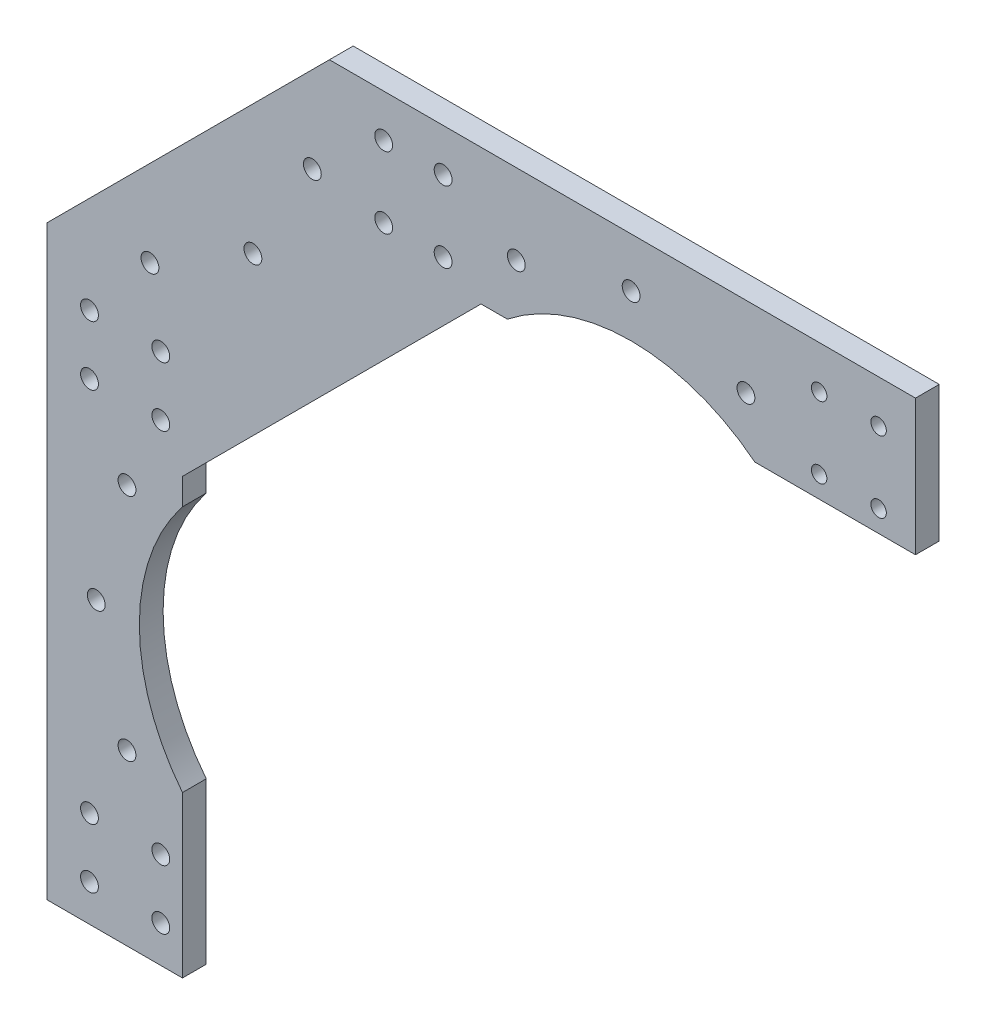
from build123d import *

# Parameters (mm, degrees)
BOSS_EXTRUDE1_DEPTH = 4
SKETCH3_R           = 1.5
SKETCH3_R_2         = 1.3
CUT_EXTRUDE1_DEPTH  = 10
SKETCH4_R           = 1.5
CUT_EXTRUDE2_DEPTH  = 140.111900832


with BuildPart() as part:
    # Sketch1 → Boss-Extrude1 (new body)
    with BuildSketch(Plane.XY):
        with BuildLine():
            Line((-98.326295957, -47.840468239), (-75.492445719, -47.840468239))
            Line((-75.492445719, -47.840468239), (-75.492445719, -20.816086355))
            ThreePointArc((-75.492445719, -20.816086355), (-82.750542947, 0), (-75.492445719, 20.816086355))
            Line((-75.492445719, 20.816086355), (-75.492445719, 25.252811288))
            Line((-75.492445719, 25.252811288), (-25.252811288, 75.492445719))
            Line((-25.252811288, 75.492445719), (-20.816086355, 75.492445719))
            ThreePointArc((-20.816086355, 75.492445719), (0, 82.750542947), (20.816086355, 75.492445719))
            Line((20.816086355, 75.492445719), (47.840468239, 75.492445719))
            Line((47.840468239, 75.492445719), (47.840468239, 98.326295957))
            Line((47.840468239, 98.326295957), (-50.769001995, 98.326295957))
            Line((-50.769001995, 98.326295957), (-98.326295957, 50.769001995))
            Line((-98.326295957, 50.769001995), (-98.326295957, -47.840468239))
        make_face()
    extrude(amount=BOSS_EXTRUDE1_DEPTH)

    # Sketch3 → Cut-Extrude1 (cut)
    with BuildSketch(Plane.XY.offset(4)):
        with Locations((-91.135133224, -41.635923431)):
            Circle(SKETCH3_R)
        with Locations((-91.135133224, -31.635923431)):
            Circle(SKETCH3_R)
        with Locations((-79.135133224, -31.635923431)):
            Circle(SKETCH3_R)
        with Locations((-79.135133224, -41.635923431)):
            Circle(SKETCH3_R)
        with Locations((-91.135133224, 31.635923431)):
            Circle(SKETCH3_R)
        with Locations((-91.135133224, 41.635923431)):
            Circle(SKETCH3_R)
        with Locations((-79.135133224, 41.635923431)):
            Circle(SKETCH3_R)
        with Locations((-79.135133224, 31.635923431)):
            Circle(SKETCH3_R)
        with Locations((31.635923431, 79.135133224)):
            Circle(SKETCH3_R_2)
        with Locations((31.635923431, 91.135133224)):
            Circle(SKETCH3_R_2)
        with Locations((41.635923431, 91.135133224)):
            Circle(SKETCH3_R_2)
        with Locations((41.635923431, 79.135133224)):
            Circle(SKETCH3_R_2)
        with Locations((-31.635923431, 79.135133224)):
            Circle(SKETCH3_R)
        with Locations((-31.635923431, 91.135133224)):
            Circle(SKETCH3_R)
        with Locations((-41.635923431, 91.135133224)):
            Circle(SKETCH3_R)
        with Locations((-41.635923431, 79.135133224)):
            Circle(SKETCH3_R)
    extrude(amount=-CUT_EXTRUDE1_DEPTH, mode=Mode.SUBTRACT)

    # Sketch4 → Cut-Extrude2 (cut, through all)
    with BuildSketch(Plane.XY.offset(4)):
        with Locations((-90, 0)):
            Circle(SKETCH4_R)
        with Locations((-63.639610307, 63.639610307)):
            Circle(SKETCH4_R)
        with Locations((0, 90)):
            Circle(SKETCH4_R)
        with Locations((-80.960118382, 53.639610307)):
            Circle(SKETCH4_R)
        with Locations((-53.639610307, 80.960118382)):
            Circle(SKETCH4_R)
        with Locations((19.318516526, 84.823619098)):
            Circle(SKETCH4_R)
        with Locations((-19.318516526, 84.823619098)):
            Circle(SKETCH4_R)
        with Locations((-84.823619098, 19.318516526)):
            Circle(SKETCH4_R)
        with Locations((-84.823619098, -19.318516526)):
            Circle(SKETCH4_R)
    extrude(amount=-CUT_EXTRUDE2_DEPTH, mode=Mode.SUBTRACT)


solid = part.part
